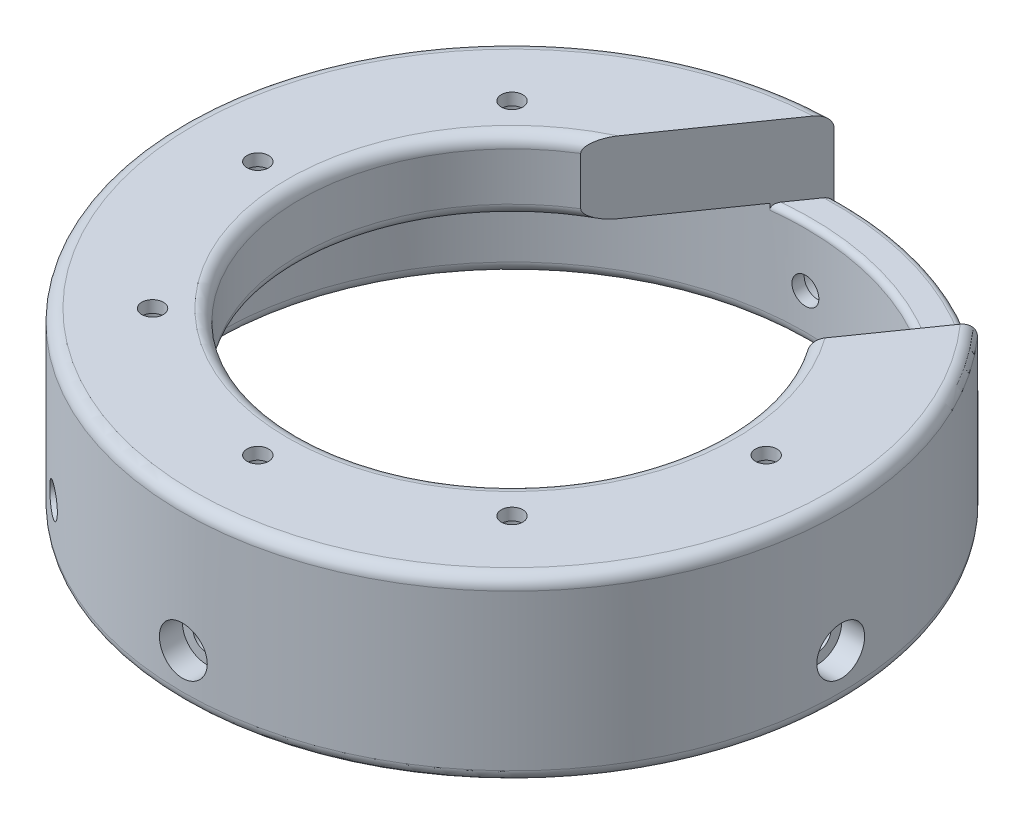
from build123d import *

# Parameters (mm, degrees)
CUT_EXTRUDE1_REACH             = 85.499
SKETCH2_R                      = 1.8
CIRPATTERN1_COUNT              = 8
CUT_EXTRUDE2_REACH             = 85.499
SKETCH3_R                      = 35.5
CBORE_START                    = 51.1
CBORE_FOR_M4_SHCS1_OUTLINE_R   = 4
CBORE_FOR_M4_SHCS1_DEPTH       = 4.000000041
CBORE_START_2                  = 49.048419853
CBORE_FOR_M4_SHCS1_2_OUTLINE_R = 2.25
CBORE_FOR_M4_SHCS1_2_DEPTH     = 2.051580147
CBORE_START_3                  = -55.100000041
CBORE_FOR_M4_SHCS2_OUTLINE_R   = 4
CBORE_FOR_M4_SHCS2_DEPTH       = 4.000000041
CBORE_START_4                  = -51.1
CBORE_FOR_M4_SHCS2_2_OUTLINE_R = 2.25
CBORE_FOR_M4_SHCS2_2_DEPTH     = 2.051580147
SKETCH11_R                     = 3.2
CUT_EXTRUDE4_DEPTH             = 10
CIRPATTERN6_COUNT              = 8
FILLET1_R                      = 2
CUT_EXTRUDE5_DEPTH             = 30
CUT_EXTRUDE5_DEPTH_BACK        = 30
SKETCH14_W                     = 45
SKETCH14_H                     = 12
SKETCH15_R                     = 2.58
CUT_EXTRUDE6_DEPTH             = 3.8
FILLET12_R                     = 1


# Read off the part's stored shape, not the designer's step: CBORE for M4 SHCS1, CBORE for M4 SHCS2
with BuildPart() as part:
    # Sketch1 → Revolve1 (revolve)
    with BuildSketch(Plane(origin=(0, 0, 0), x_dir=(0, 0, -1), z_dir=(1, 0, 0))):
        Polygon((0, 0), (0, 12), (55.1, 12), (55.1, -18), (49.1, -18), (49.1, 0), align=None)
    revolve(axis=Axis((0, 0, 0), (0, 1, 0)))

    # Sketch2 → Cut-Extrude1 (cut, up to next)
    with BuildSketch(Plane(origin=(0, 12, 0), x_dir=(1, 0, 0), z_dir=(0, 1, 0)), mode=Mode.PRIVATE) as cut_extrude1_sk1:
        with Locations(Location((0, 42.5, 0), (0, 0, 270))):
            Circle(SKETCH2_R)
    cut_extrude1_tool1 = extrude(cut_extrude1_sk1.sketch, amount=-CUT_EXTRUDE1_REACH, mode=Mode.PRIVATE) & part.part
    cut_extrude1 = cut_extrude1_tool1.solids().sort_by_distance((0, 12, -42.5))[0]
    add(cut_extrude1, mode=Mode.SUBTRACT)

    # CirPattern1: Cut-Extrude1 ×8 about axis
    cirpattern1_axis = Axis((0, 0, 0), (0, 1, 0))
    for i in range(1, CIRPATTERN1_COUNT):
        add(cut_extrude1.rotate(cirpattern1_axis, i * 360 / CIRPATTERN1_COUNT), mode=Mode.SUBTRACT)

    # Sketch3 → Cut-Extrude2 (cut, up to next)
    with BuildSketch(Plane(origin=(0, 12, 0), x_dir=(1, 0, 0), z_dir=(0, 1, 0)), mode=Mode.PRIVATE) as cut_extrude2_sk1:
        with Locations(Location((0, 0, 0), (0, 0, 270))):
            Circle(SKETCH3_R)
    cut_extrude2_tool1 = extrude(cut_extrude2_sk1.sketch, amount=-CUT_EXTRUDE2_REACH, mode=Mode.PRIVATE) & part.part
    add(cut_extrude2_tool1.solids().sort_by_distance((0, 12, 0))[0], mode=Mode.SUBTRACT)

    # CBORE for M4 SHCS1 outline → CBORE for M4 SHCS1 (cut)
    with BuildSketch(Plane.XY.offset(CBORE_START)):
        with Locations((0, -10)):
            Circle(CBORE_FOR_M4_SHCS1_OUTLINE_R)
    cbore_for_m4_shcs1 = extrude(amount=CBORE_FOR_M4_SHCS1_DEPTH, mode=Mode.SUBTRACT)

    # CBORE for M4 SHCS1 2 outline → CBORE for M4 SHCS1 2 (cut)
    with BuildSketch(Plane.XY.offset(CBORE_START_2)):
        with Locations((0, -10)):
            Circle(CBORE_FOR_M4_SHCS1_2_OUTLINE_R)
    cbore_for_m4_shcs1_2 = extrude(amount=CBORE_FOR_M4_SHCS1_2_DEPTH, mode=Mode.SUBTRACT)

    # Mirror2: CBORE for M4 SHCS1, CBORE for M4 SHCS1 2 across plane
    add(cbore_for_m4_shcs1.mirror(Plane.XY), mode=Mode.SUBTRACT)
    add(cbore_for_m4_shcs1_2.mirror(Plane.XY), mode=Mode.SUBTRACT)

    # CBORE for M4 SHCS2 outline → CBORE for M4 SHCS2 (cut)
    with BuildSketch(Plane.YZ.offset(CBORE_START_3)):
        with Locations((-10, 0)):
            Circle(CBORE_FOR_M4_SHCS2_OUTLINE_R)
    cbore_for_m4_shcs2 = extrude(amount=CBORE_FOR_M4_SHCS2_DEPTH, mode=Mode.SUBTRACT)

    # CBORE for M4 SHCS2 2 outline → CBORE for M4 SHCS2 2 (cut)
    with BuildSketch(Plane.YZ.offset(CBORE_START_4)):
        with Locations((-10, 0)):
            Circle(CBORE_FOR_M4_SHCS2_2_OUTLINE_R)
    cbore_for_m4_shcs2_2 = extrude(amount=CBORE_FOR_M4_SHCS2_2_DEPTH, mode=Mode.SUBTRACT)

    # Mirror3: CBORE for M4 SHCS2, CBORE for M4 SHCS2 2 across plane
    add(cbore_for_m4_shcs2.mirror(Plane(origin=(0, 0, 0), x_dir=(0, 0, 1), z_dir=(1, 0, 0))), mode=Mode.SUBTRACT)
    add(cbore_for_m4_shcs2_2.mirror(Plane(origin=(0, 0, 0), x_dir=(0, 0, 1), z_dir=(1, 0, 0))), mode=Mode.SUBTRACT)

    # Sketch11 → Cut-Extrude4 (cut)
    with BuildSketch(Plane.XZ):
        with Locations(Location((0, 42.5, 0), (0, 0, 270))):
            Circle(SKETCH11_R)
    cut_extrude4 = extrude(amount=-CUT_EXTRUDE4_DEPTH, mode=Mode.SUBTRACT)

    # CirPattern6: Cut-Extrude4 ×8 about axis
    cirpattern6_axis = Axis((0, 0, 0), (0, 1, 0))
    for i in range(1, CIRPATTERN6_COUNT):
        add(cut_extrude4.rotate(cirpattern6_axis, i * 360 / CIRPATTERN6_COUNT), mode=Mode.SUBTRACT)

    # Fillet1
    fillet1_edges = [part.edges().sort_by_distance(p)[0] for p in [
        (0, 0, -35.5),
        (0, 12, -35.5),
        (0, -18, 49.1),
        (0, -18, 55.1),
        (0, 12, 55.1),
    ]]
    fillet(fillet1_edges, radius=FILLET1_R)

    # Sketch14 → Cut-Extrude5 (cut, two sides: drawn at the far end of the back side and taken through both)
    with BuildSketch(Plane(origin=(95.462512605, 0, 15.760400788), x_dir=(0.8190841914010916, 0, 0.5736733281204732), z_dir=(-0.5736733281204732, 0, 0.8190841914010916)).offset(-CUT_EXTRUDE5_DEPTH_BACK)):
        with Locations((-97.358059881, 6)):
            Rectangle(SKETCH14_W, SKETCH14_H)
    extrude(amount=CUT_EXTRUDE5_DEPTH + CUT_EXTRUDE5_DEPTH_BACK, mode=Mode.SUBTRACT)

    # Sketch15 → Cut-Extrude6 (cut)
    with BuildSketch(Plane(origin=(31.609400379, 0, -45.131538946), x_dir=(-0.8190841914010915, 0, -0.5736733281204732), z_dir=(0.5736733281204732, 0, -0.8190841914010915))):
        with Locations((0, -9)):
            Circle(SKETCH15_R)
    cut_extrude6 = extrude(amount=-CUT_EXTRUDE6_DEPTH, mode=Mode.SUBTRACT)

    # Mirror4: Cut-Extrude6 across plane
    add(cut_extrude6.mirror(Plane(origin=(0, 0, 0), x_dir=(0.8190841914010915, 0, 0.5736733281204733), z_dir=(0.5736733281204732, 0, -0.8190841914010915))), mode=Mode.SUBTRACT)

    # Fillet12
    # the kernel refuses this fillet: 1 mm, written as the material it takes off along each edge
    with BuildSketch(Plane(origin=(0, 0, 0), x_dir=(0, 0, -1), z_dir=(-1, 0, 0))) as fillet12_piece_1_section:
        with BuildLine():
            CenterArc((55.1 - FILLET12_R, FILLET12_R), FILLET12_R, 270, 90)
            Line((55.1 - FILLET12_R, 0), (55.1, 0))
            Line((55.1, 0), (55.1, FILLET12_R))
        make_face()
    fillet12_piece_1 = revolve(axis=Axis((0, 0, 0), (0, -1, 0)), revolution_arc=50.585671323, mode=Mode.PRIVATE)
    fillet12_piece_1 = split(fillet12_piece_1, bisect_by=Plane(origin=(41.019775415, -0.277723252, -36.99588581), z_dir=(-0.8190841914010917, 1.2315186985197486e-15, -0.5736733281204733)), keep=Keep.TOP, mode=Mode.PRIVATE)
    add(fillet12_piece_1, mode=Mode.SUBTRACT)
    with BuildSketch(Plane(origin=(0, 0, 0), x_dir=(0.7935935525729921, 0, -0.6084482503176236), z_dir=(0.6084482503176236, 0, 0.7935935525729921))) as fillet12_piece_2_section:
        with BuildLine():
            CenterArc((49.1 + FILLET12_R, -FILLET12_R), FILLET12_R, 90, 90)
            Line((49.1 + FILLET12_R, 0), (49.1, 0))
            Line((49.1, 0), (49.1, -FILLET12_R))
        make_face()
    fillet12_piece_2 = revolve(axis=Axis((0, 0, 0), (0, 1, 0)), revolution_arc=52.522614263, mode=Mode.PRIVATE)
    fillet12_piece_2 = split(fillet12_piece_2, bisect_by=Plane(origin=(38.015080678, -0.278102683, -32.705817162), z_dir=(-0.8190841914010917, 1.2315186985197486e-15, -0.5736733281204733)), keep=Keep.TOP, mode=Mode.PRIVATE)
    add(fillet12_piece_2, mode=Mode.SUBTRACT)
    with BuildSketch(Plane(origin=(0, 0, 0), x_dir=(0, 0, -1), z_dir=(1, 0, 0))) as fillet12_piece_3_section:
        with BuildLine():
            CenterArc((49.1 + FILLET12_R, -FILLET12_R), FILLET12_R, 90, 90)
            Line((49.1 + FILLET12_R, 0), (49.1, 0))
            Line((49.1, 0), (49.1, -FILLET12_R))
        make_face()
    fillet12_piece_3 = revolve(axis=Axis((0, 0, 0), (0, 1, 0)), revolution_arc=9.551311708, mode=Mode.PRIVATE)
    fillet12_piece_3 = split(fillet12_piece_3, bisect_by=Plane(origin=(-4.503613028, -0.226254878, -50.439969418), z_dir=(0.8190841914010917, 0, 0.5736733281204733)), keep=Keep.TOP, mode=Mode.PRIVATE)
    add(fillet12_piece_3, mode=Mode.SUBTRACT)
    with BuildSketch(Plane(origin=(0, 0, 0), x_dir=(-0.0680026133976687, 0, -0.997685143004088), z_dir=(-0.997685143004088, 0, 0.0680026133976687))) as fillet12_piece_4_section:
        with BuildLine():
            CenterArc((55.1 - FILLET12_R, FILLET12_R), FILLET12_R, 270, 90)
            Line((55.1 - FILLET12_R, 0), (55.1, 0))
            Line((55.1, 0), (55.1, FILLET12_R))
        make_face()
    fillet12_piece_4 = revolve(axis=Axis((0, 0, 0), (0, -1, 0)), revolution_arc=3.89927196, mode=Mode.PRIVATE)
    fillet12_piece_4 = split(fillet12_piece_4, bisect_by=Plane(origin=(-1.181998259, -0.212886538, -55.182532849), z_dir=(0.8190841914010917, 0, 0.5736733281204733)), keep=Keep.TOP, mode=Mode.PRIVATE)
    add(fillet12_piece_4, mode=Mode.SUBTRACT)


solid = part.part
